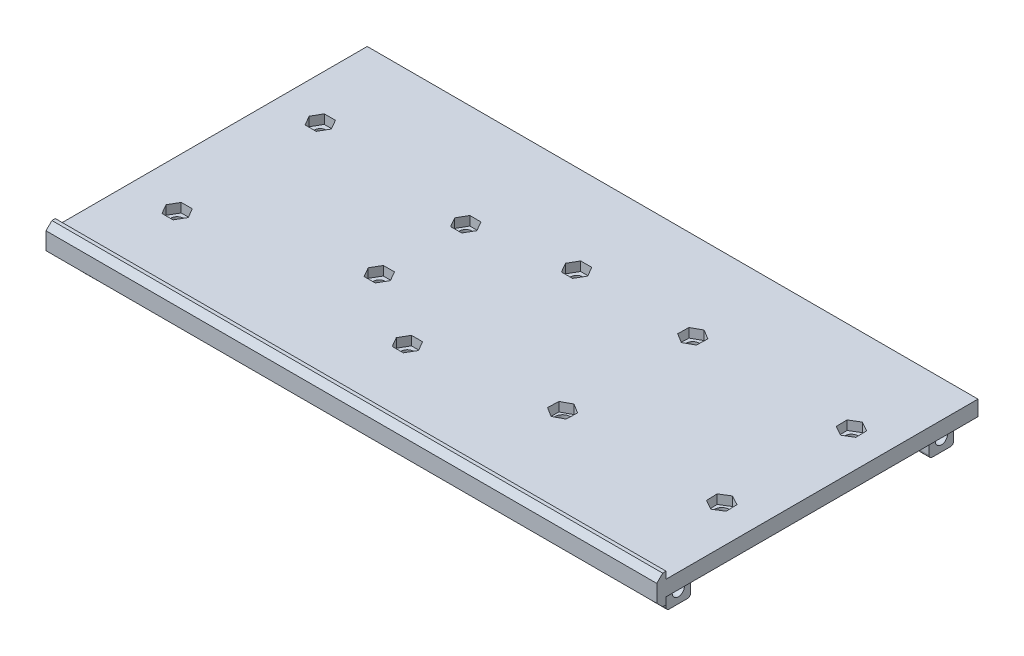
from build123d import *

# Parameters (mm, degrees)
CROQUIS3_W              = 200
CROQUIS3_H              = 100
CROQUIS3_R              = 2.45
CROQUIS3_R_2            = 2.450173308
SALIENTE_EXTRUIR1_DEPTH = 5
SALIENTE_EXTRUIR2_START = -9
CROQUIS4_R              = 3.372577113
CROQUIS4_R_2            = 1.872577113
CROQUIS4_R_3            = 3.527614965
CROQUIS4_R_4            = 2.027614965
CROQUIS4_R_5            = 3.462984948
CROQUIS4_R_6            = 1.962984948
CROQUIS4_R_7            = 3.478351446
CROQUIS4_R_8            = 1.978351446
CROQUIS4_R_9            = 3.459412365
CROQUIS4_R_10           = 1.959412365
CROQUIS4_R_11           = 3.625491316
CROQUIS4_R_12           = 2.125491316
CROQUIS4_R_13           = 4.450173308
CROQUIS4_R_14           = 2.450173308
CROQUIS4_R_15           = 4.124173106
CROQUIS4_R_16           = 2.124173106
CROQUIS4_R_17           = 4.031387243
CROQUIS4_R_18           = 2.031387243
CROQUIS4_R_19           = 4.264908663
CROQUIS4_R_20           = 2.264908663
SALIENTE_EXTRUIR2_DEPTH = 9
SALIENTE_EXTRUIR3_DEPTH = 200
CROQUIS9_W              = 5
CROQUIS9_H              = 8
SALIENTE_EXTRUIR4_DEPTH = 8
REDONDEO1_R             = 1
CROQUIS11_W             = 8
CROQUIS11_H             = 6
SALIENTE_EXTRUIR5_DEPTH = 8
REDONDEO3_R             = 2
CROQUIS13_R             = 2
CORTAR_EXTRUIR3_DEPTH   = 6
CORTAR_EXTRUIR4_START   = -6
CROQUIS14_R             = 2
CORTAR_EXTRUIR4_DEPTH   = 6
CROQUIS15_R             = 2
CORTAR_EXTRUIR5_DEPTH   = 6
CORTAR_EXTRUIR6_DEPTH   = 2.6
MATRIZL1_COUNT          = 2
MATRIZL1_PITCH          = 184.6
CORTAR_EXTRUIR7_DEPTH   = 2.6
MATRIZL2_COUNT          = 2
MATRIZL2_PITCH          = 100
CROQUIS25_R             = 1.872577113
CROQUIS25_R_2           = 2.125491316
CROQUIS25_R_3           = 1.959412365
CROQUIS25_R_4           = 1.978351446
CROQUIS25_R_5           = 1.962984948
CROQUIS25_R_6           = 2.027614965
CORTAR_EXTRUIR8_DEPTH   = 10
CORTAR_EXTRUIR9_START   = 2
CORTAR_EXTRUIR9_DEPTH   = 14
CHAFL_N1_SIZE           = 1


with BuildPart() as part:
    # Croquis3 → Saliente-Extruir1 (new body)
    with BuildSketch(Plane(origin=(0, 0, 0), x_dir=(1, 0, 0), z_dir=(0, 1, 0))):
        with Locations((-16.001013851, 0)):
            Rectangle(CROQUIS3_W, CROQUIS3_H)
        with Locations((19.48962591, 21.100676249)):
            Circle(CROQUIS3_R, mode=Mode.SUBTRACT)
        with Locations((71.658007858, 20.901971031)):
            Circle(CROQUIS3_R, mode=Mode.SUBTRACT)
        with Locations((71.377578013, -21.310716777)):
            Circle(CROQUIS3_R, mode=Mode.SUBTRACT)
        with Locations((19.142498915, -21.188320431)):
            Circle(CROQUIS3_R_2, mode=Mode.SUBTRACT)
    extrude(amount=SALIENTE_EXTRUIR1_DEPTH)

    # Croquis4 → Saliente-Extruir2 (add)
    # profile 1 of 10: a face of its own
    with BuildSketch(Plane(origin=(0, 5, 0), x_dir=(1, 0, 0), z_dir=(0, 1, 0)).offset(SALIENTE_EXTRUIR2_START)):
        with Locations((-102.096455474, 20.709667607)):
            Circle(CROQUIS4_R)
        with Locations((-102.096455474, 20.709667607)):
            Circle(CROQUIS4_R_2, mode=Mode.SUBTRACT)
    # profile 2 of 10: a face of its own
    with BuildSketch(Plane(origin=(0, 5, 0), x_dir=(1, 0, 0), z_dir=(0, 1, 0)).offset(SALIENTE_EXTRUIR2_START)):
        with Locations((-100.424609792, -27.825911713)):
            Circle(CROQUIS4_R_3)
        with Locations((-100.424609792, -27.825911713)):
            Circle(CROQUIS4_R_4, mode=Mode.SUBTRACT)
    # profile 3 of 10: a face of its own
    with BuildSketch(Plane(origin=(0, 5, 0), x_dir=(1, 0, 0), z_dir=(0, 1, 0)).offset(SALIENTE_EXTRUIR2_START)):
        with Locations((-49.441800463, -12.612645778)):
            Circle(CROQUIS4_R_5)
        with Locations((-49.441800463, -12.612645778)):
            Circle(CROQUIS4_R_6, mode=Mode.SUBTRACT)
    # profile 4 of 10: a face of its own
    with BuildSketch(Plane(origin=(0, 5, 0), x_dir=(1, 0, 0), z_dir=(0, 1, 0)).offset(SALIENTE_EXTRUIR2_START)):
        with Locations((-25.022694884, -27.825911713)):
            Circle(CROQUIS4_R_7)
        with Locations((-25.022694884, -27.825911713)):
            Circle(CROQUIS4_R_8, mode=Mode.SUBTRACT)
    # profile 5 of 10: a face of its own
    with BuildSketch(Plane(origin=(0, 5, 0), x_dir=(1, 0, 0), z_dir=(0, 1, 0)).offset(SALIENTE_EXTRUIR2_START)):
        with Locations((-18.417307326, 20.979986322)):
            Circle(CROQUIS4_R_9)
        with Locations((-18.417307326, 20.979986322)):
            Circle(CROQUIS4_R_10, mode=Mode.SUBTRACT)
    # profile 6 of 10: a face of its own
    with BuildSketch(Plane(origin=(0, 5, 0), x_dir=(1, 0, 0), z_dir=(0, 1, 0)).offset(SALIENTE_EXTRUIR2_START)):
        with Locations((-49.441800463, 15.715109098)):
            Circle(CROQUIS4_R_11)
        with Locations((-49.441800463, 15.715109098)):
            Circle(CROQUIS4_R_12, mode=Mode.SUBTRACT)
    # profile 7 of 10: a face of its own
    with BuildSketch(Plane(origin=(0, 5, 0), x_dir=(1, 0, 0), z_dir=(0, 1, 0)).offset(SALIENTE_EXTRUIR2_START)):
        with Locations((19.142498915, -21.188320431)):
            Circle(CROQUIS4_R_13)
        with Locations((19.142498915, -21.188320431)):
            Circle(CROQUIS4_R_14, mode=Mode.SUBTRACT)
    # profile 8 of 10: a face of its own
    with BuildSketch(Plane(origin=(0, 5, 0), x_dir=(1, 0, 0), z_dir=(0, 1, 0)).offset(SALIENTE_EXTRUIR2_START)):
        with Locations((19.48962591, 21.100676249)):
            Circle(CROQUIS4_R_15)
        with Locations((19.48962591, 21.100676249)):
            Circle(CROQUIS4_R_16, mode=Mode.SUBTRACT)
    # profile 9 of 10: a face of its own
    with BuildSketch(Plane(origin=(0, 5, 0), x_dir=(1, 0, 0), z_dir=(0, 1, 0)).offset(SALIENTE_EXTRUIR2_START)):
        with Locations((71.658007858, 20.901971031)):
            Circle(CROQUIS4_R_17)
        with Locations((71.658007858, 20.901971031)):
            Circle(CROQUIS4_R_18, mode=Mode.SUBTRACT)
    # profile 10 of 10: a face of its own
    with BuildSketch(Plane(origin=(0, 5, 0), x_dir=(1, 0, 0), z_dir=(0, 1, 0)).offset(SALIENTE_EXTRUIR2_START)):
        with Locations((71.377578013, -21.310716777)):
            Circle(CROQUIS4_R_19)
        with Locations((71.377578013, -21.310716777)):
            Circle(CROQUIS4_R_20, mode=Mode.SUBTRACT)
    extrude(amount=SALIENTE_EXTRUIR2_DEPTH)

    # Croquis8 → Saliente-Extruir3 (add)
    with BuildSketch(Plane(origin=(83.998986149, 0, 0), x_dir=(0, 0, -1), z_dir=(1, 0, 0))):
        Polygon((-50, 5), (-52.132961521, 5), (-52.132961521, 7.264269383), (-53.250029395, 7.264269383), (-55.186280375, 5.328018403), (-55.186280375, -0.328018403), (-53.250029395, -2.264269383), (-52.132961521, -2.264269383), (-52.132961521, 0), (-50, 0), align=None)
    extrude(amount=-SALIENTE_EXTRUIR3_DEPTH)

    # Croquis9 → Saliente-Extruir4 (add)
    with BuildSketch(Plane.XZ):
        with Locations((-109.501013851, 44.132961521)):
            Rectangle(CROQUIS9_W, CROQUIS9_H)
        with Locations((77.498986149, 44.132961521)):
            Rectangle(CROQUIS9_W, CROQUIS9_H)
        with Locations((77.498986149, -42)):
            Rectangle(CROQUIS9_W, CROQUIS9_H)
        with Locations((-109.501013851, -42)):
            Rectangle(CROQUIS9_W, CROQUIS9_H)
    extrude(amount=SALIENTE_EXTRUIR4_DEPTH)

    # Redondeo1
    redondeo1_edges = [part.edges().sort_by_distance(p)[0] for p in [
        (-109.501013851, -8, 40.132961521),
        (-109.501013851, -8, 48.132961521),
        (-109.501013851, -8, -38),
        (-109.501013851, -8, -46),
        (77.498986149, -8, -38),
        (77.498986149, -8, -46),
        (77.498986149, -8, 40.132961521),
        (77.498986149, -8, 48.132961521),
    ]]
    fillet(redondeo1_edges, radius=REDONDEO1_R)

    # Croquis11 → Saliente-Extruir5 (add)
    with BuildSketch(Plane.XZ):
        with Locations((-53.435930005, -43)):
            Rectangle(CROQUIS11_W, CROQUIS11_H)
        with Locations((46.564069995, -43)):
            Rectangle(CROQUIS11_W, CROQUIS11_H)
    extrude(amount=SALIENTE_EXTRUIR5_DEPTH)

    # Redondeo3
    redondeo3_edges = [part.edges().sort_by_distance(p)[0] for p in [
        (-57.435930005, -8, -43),
        (-49.435930005, -8, -43),
        (42.564069995, -8, -43),
        (50.564069995, -8, -43),
    ]]
    fillet(redondeo3_edges, radius=REDONDEO3_R)

    # Croquis13 → Cortar-Extruir3 (cut)
    with BuildSketch(Plane.ZY.offset(112.001013851)):
        with Locations((-42, -4)):
            Circle(CROQUIS13_R)
        with Locations((44.132961521, -4)):
            Circle(CROQUIS13_R)
    extrude(amount=-CORTAR_EXTRUIR3_DEPTH, mode=Mode.SUBTRACT)

    # Croquis14 → Cortar-Extruir4 (cut)
    with BuildSketch(Plane(origin=(79.998986149, 0, 0), x_dir=(0, 0, -1), z_dir=(1, 0, 0)).offset(CORTAR_EXTRUIR4_START)):
        with Locations((-44.132961521, -4)):
            Circle(CROQUIS14_R)
        with Locations((42, -4)):
            Circle(CROQUIS14_R)
    extrude(amount=CORTAR_EXTRUIR4_DEPTH, mode=Mode.SUBTRACT)

    # Croquis15 → Cortar-Extruir5 (cut)
    with BuildSketch(Plane(origin=(0, 0, -46), x_dir=(-1, 0, 0), z_dir=(0, 0, -1))):
        with Locations((-46.564069995, -4)):
            Circle(CROQUIS15_R)
        with Locations((53.435930005, -4)):
            Circle(CROQUIS15_R)
    extrude(amount=-CORTAR_EXTRUIR5_DEPTH, mode=Mode.SUBTRACT)

    # Croquis16 → Cortar-Extruir6 (cut)
    with BuildSketch(Plane(origin=(-107.001013851, 0, 0), x_dir=(0, 0, -1), z_dir=(1, 0, 0))):
        Polygon((38.976602349, -5.690877477), (41.952644025, -7.46377791), (44.976041676, -5.772900433), (45.023397651, -2.309122523), (42.047355975, -0.53622209), (39.023958324, -2.227099567), align=None)
        Polygon((-47.039621901, -5.88449607), (-43.954270242, -7.459489764), (-41.047609862, -5.574993694), (-41.226301141, -2.11550393), (-44.311652801, -0.540510236), (-47.218313181, -2.425006306), align=None)
    cortar_extruir6 = extrude(amount=-CORTAR_EXTRUIR6_DEPTH, mode=Mode.SUBTRACT)

    # MatrizL1: Cortar-Extruir6 ×2
    with Locations(*[(i * MATRIZL1_PITCH, 0, 0) for i in range(1, MATRIZL1_COUNT)]):
        add(cortar_extruir6, mode=Mode.SUBTRACT)

    # Croquis17 → Cortar-Extruir7 (cut)
    with BuildSketch(Plane.XY.offset(-40)):
        Polygon((49.555525945, -2.253234047), (46.54705428, -0.535940176), (43.555598329, -2.282706129), (43.572614044, -5.746765953), (46.58108571, -7.464059824), (49.57254166, -5.717293871), align=None)
    cortar_extruir7 = extrude(amount=-CORTAR_EXTRUIR7_DEPTH, mode=Mode.SUBTRACT)

    # MatrizL2: Cortar-Extruir7 ×2
    with Locations(*[(-i * MATRIZL2_PITCH, 0, 0) for i in range(1, MATRIZL2_COUNT)]):
        add(cortar_extruir7, mode=Mode.SUBTRACT)

    # Croquis25 → Cortar-Extruir8 (cut)
    with BuildSketch(Plane(origin=(0, 0, 0), x_dir=(1, 0, 0), z_dir=(0, 1, 0))):
        with Locations((-102.096455474, 20.709667607)):
            Circle(CROQUIS25_R)
        with Locations((-49.441800463, 15.715109098)):
            Circle(CROQUIS25_R_2)
        with Locations((-18.417307326, 20.979986322)):
            Circle(CROQUIS25_R_3)
        with Locations((-25.022694884, -27.825911713)):
            Circle(CROQUIS25_R_4)
        with Locations((-49.441800463, -12.612645778)):
            Circle(CROQUIS25_R_5)
        with Locations((-100.424609792, -27.825911713)):
            Circle(CROQUIS25_R_6)
    extrude(amount=CORTAR_EXTRUIR8_DEPTH, mode=Mode.SUBTRACT)

    # Croquis26 → Cortar-Extruir9 (cut)
    with BuildSketch(Plane(origin=(0, 0, 0), x_dir=(1, 0, 0), z_dir=(0, 1, 0)).offset(CORTAR_EXTRUIR9_START)):
        Polygon((-14.78000063, 20.979986322), (-16.598653978, 24.129986322), (-20.235960674, 24.129986322), (-22.054614022, 20.979986322), (-20.235960674, 17.829986322), (-16.598653978, 17.829986322), align=None)
        Polygon((-21.385388188, -27.825911713), (-23.204041536, -24.675911713), (-26.841348232, -24.675911713), (-28.66000158, -27.825911713), (-26.841348232, -30.975911713), (-23.204041536, -30.975911713), align=None)
        Polygon((-45.804493767, -12.612645778), (-47.623147115, -9.462645778), (-51.260453811, -9.462645778), (-53.079107159, -12.612645778), (-51.260453811, -15.762645778), (-47.623147115, -15.762645778), align=None)
        Polygon((-45.804493767, 15.715109098), (-47.623147115, 18.865109098), (-51.260453811, 18.865109098), (-53.079107159, 15.715109098), (-51.260453811, 12.565109098), (-47.623147115, 12.565109098), align=None)
        Polygon((-98.459148778, 20.709667607), (-100.277802126, 23.859667607), (-103.915108822, 23.859667607), (-105.73376217, 20.709667607), (-103.915108822, 17.559667607), (-100.277802126, 17.559667607), align=None)
        Polygon((-96.787303096, -27.825911713), (-98.605956444, -24.675911713), (-102.24326314, -24.675911713), (-104.061916488, -27.825911713), (-102.24326314, -30.975911713), (-98.605956444, -30.975911713), align=None)
        Polygon((22.68409848, 22.84002814), (19.580539271, 24.736846592), (16.386066701, 22.997494701), (16.29515334, 19.361324358), (19.398712549, 17.464505907), (22.593185118, 19.203857798), align=None)
        Polygon((74.768281649, 22.787759181), (71.58000431, 24.538441222), (68.469730519, 22.652653072), (68.547734067, 19.016182882), (71.736011406, 17.265500841), (74.846285197, 19.15128899), align=None)
        Polygon((74.466204821, -19.389679443), (71.258224284, -17.675368831), (68.169597476, -19.596406165), (68.288951205, -23.231754111), (71.496931742, -24.946064722), (74.58555855, -23.025027388), align=None)
        Polygon((22.350400487, -19.47386206), (19.261685198, -17.552966992), (16.053783626, -19.267425363), (15.934597343, -22.902778802), (19.023312632, -24.823673871), (22.231214204, -23.1092155), align=None)
    extrude(amount=CORTAR_EXTRUIR9_DEPTH, mode=Mode.SUBTRACT)

    # Chaflán1
    chafl_n1_edges = [part.edges().sort_by_distance(p)[0] for p in [
        (67.112669349, -4, 21.310716777),
        (67.626620615, -4, -20.901971031),
        (15.365452804, -4, -21.100676249),
        (14.692325607, -4, 21.188320431),
        (-28.50104633, -4, 27.825911713),
        (-21.876719691, -4, -20.979986322),
        (-53.067291779, -4, -15.715109098),
        (-52.90478541, -4, 12.612645778),
        (-103.952224757, -4, 27.825911713),
        (-105.469032587, -4, -20.709667607),
    ]]
    chamfer(chafl_n1_edges, length=CHAFL_N1_SIZE)


solid = part.part
